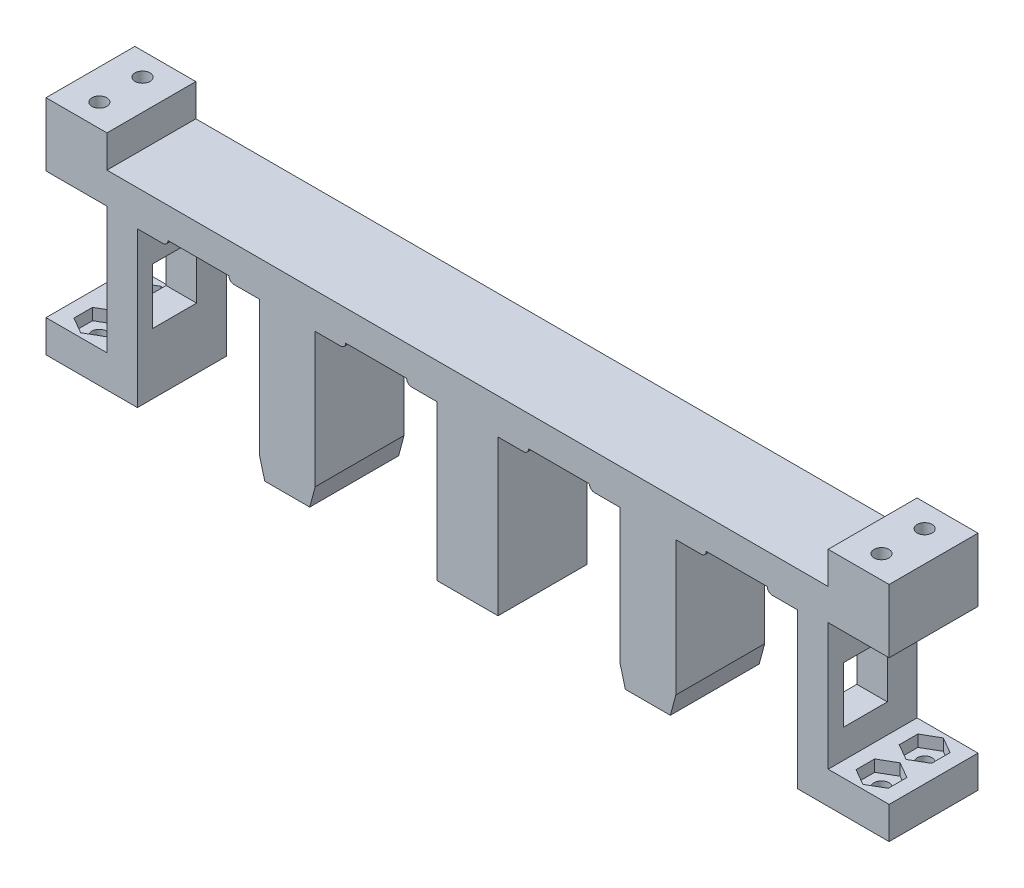
from build123d import *
from OCP.BRepFilletAPI import BRepFilletAPI_MakeChamfer

# Parameters (mm, degrees)
BOSS_EXTRUDE1_DEPTH       = 17.5
FILLET1_R                 = 1
CHAMFER1_SIZE             = 4
CHAMFER1_SIZE2            = 1.07179677
F_4_CLEARANCE_HOLE1_D     = 2.9464
F_4_CLEARANCE_HOLE1_DEPTH = 6.35
CUT_EXTRUDE3_START        = -2.286
CUT_EXTRUDE3_DEPTH        = 29.572
SKETCH8_W                 = 8.65
SKETCH8_H                 = 11
CUT_EXTRUDE2_DEPTH        = 10
F_4_CLEARANCE_HOLE2_D     = 2.9464


with BuildPart() as part:
    # Sketch1 → Boss-Extrude1 (new body)
    with BuildSketch(Plane.XY):
        Polygon((-47.5, 6.35), (-35.5, 6.35), (-35.5, 31.35), (-47.5, 31.35), (-47.5, 43.85), (-35.5, 43.85), (-35.5, 37.5), (35.5, 37.5), (35.5, 0), (29.5, 0), (29.5, 30.5), (23.5, 30.5), (23.5, 31.5), (11.5, 31.5), (11.5, 30.5), (5.5, 30.5), (5.5, 0), (-5.5, 0), (-5.5, 30.5), (-11.5, 30.5), (-11.5, 31.5), (-23.5, 31.5), (-23.5, 30.5), (-29.5, 30.5), (-29.5, 0), (-47.5, 0), align=None)
    extrude(amount=BOSS_EXTRUDE1_DEPTH)

    # Fillet1
    fillet1_edges = [part.edges().sort_by_distance(p)[0] for p in [
        (-11.5, 30.5, 8.75),
        (-23.5, 30.5, 8.75),
        (23.5, 30.5, 8.75),
        (11.5, 30.5, 8.75),
    ]]
    fillet(fillet1_edges, radius=FILLET1_R - 0.0001)  # a hair under: the kernel refuses the full size

    # Chamfer1: one chamfer whose edges measure the first distance from different faces: ONE call of the kernel's chamfer builder (chamfer() names one face for all edges)
    chamfer1_edges_1 = [part.edges().sort_by_distance(p)[0] for p in [
        (5.5, 0, 8.75),
    ]]
    chamfer1_side_1 = [part.faces().sort_by_distance(p)[0] for p in [
        (5.5, 15.25, 8.75),
    ]]
    chamfer1_edges_2 = [part.edges().sort_by_distance(p)[0] for p in [
        (-5.5, 0, 8.75),
    ]]
    chamfer1_side_2 = [part.faces().sort_by_distance(p)[0] for p in [
        (-5.5, 15.25, 8.75),
    ]]
    chamfer1 = BRepFilletAPI_MakeChamfer(part.part.solid().wrapped)
    for e in chamfer1_edges_1:
        chamfer1.Add(CHAMFER1_SIZE, CHAMFER1_SIZE2, e.wrapped, chamfer1_side_1[0].wrapped)  # the first distance lies on this face
    for e in chamfer1_edges_2:
        chamfer1.Add(CHAMFER1_SIZE, CHAMFER1_SIZE2, e.wrapped, chamfer1_side_2[0].wrapped)  # the first distance lies on this face
    add(Compound.cast(chamfer1.Shape()), mode=Mode.REPLACE)

    # #4 Clearance Hole1
    with Locations(Plane(origin=(0, 6.35, 0), x_dir=(1, 0, 0), z_dir=(0, 1, 0))):
        with Locations((-41.5, -4.5), (-41.5, -13)):
            Hole(F_4_CLEARANCE_HOLE1_D / 2, depth=F_4_CLEARANCE_HOLE1_DEPTH)

    # Sketch9 → Cut-Extrude3 (cut)
    with BuildSketch(Plane(origin=(0, 6.35, 0), x_dir=(1, 0, 0), z_dir=(0, 1, 0)).offset(CUT_EXTRUDE3_START)):
        Polygon((-41.5, -9.333825791), (-44.675, -11.166912895), (-44.675, -14.833087105), (-41.5, -16.666174209), (-38.325, -14.833087105), (-38.325, -11.166912895), align=None)
        Polygon((-38.325, -6.333087105), (-38.325, -2.666912895), (-41.5, -0.833825791), (-44.675, -2.666912895), (-44.675, -6.333087105), (-41.5, -8.166174209), align=None)
    extrude(amount=CUT_EXTRUDE3_DEPTH, mode=Mode.SUBTRACT)

    # Sketch8 → Cut-Extrude2 (cut)
    with BuildSketch(Plane.ZY.offset(35.5)):
        with Locations((10.175, 17.5)):
            Rectangle(SKETCH8_W, SKETCH8_H)
    extrude(amount=-CUT_EXTRUDE2_DEPTH, mode=Mode.SUBTRACT)

    # #4 Clearance Hole2 (through all)
    with Locations(Plane(origin=(0, 31.35, 0), x_dir=(-1, 0, 0), z_dir=(0, -1, 0))):
        with Locations((41.5, -13), (41.5, -4.5)):
            Hole(F_4_CLEARANCE_HOLE2_D / 2)

    # Mirror1: part across plane


with BuildPart() as part_1:
    add(part.part)
    add(part.part.mirror(Plane(origin=(35.5, 37.5, 17.5), x_dir=(0, 0, 1), z_dir=(-1, 0, 0))))


solid = part_1.part
